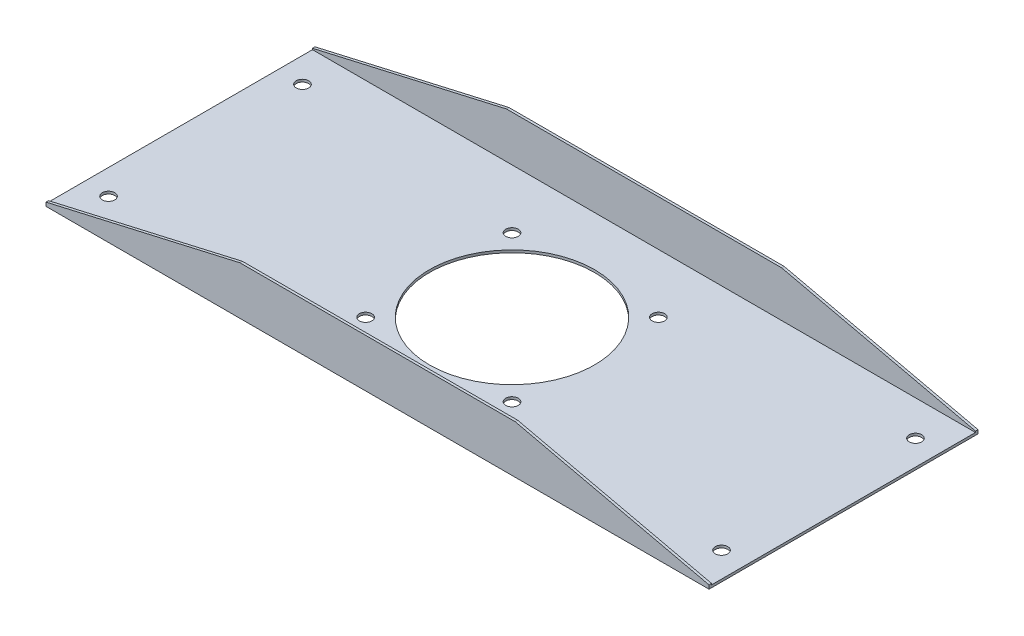
from build123d import *

# Parameters (mm, degrees)
EXTRUDE_1_DEPTH     = 530
SKETCH_2_OUTSIDE_W  = 646.648
SKETCH_2_OUTSIDE_H  = 155.148
CUT_EXTRUDE_2_DEPTH = 574.242749627
SKETCH_3_R          = 5
SKETCH_3_R_2        = 66
CUT_EXTRUDE_3_DEPTH = 543.523962604


with BuildPart() as part:
    # Эскиз1 → Вытянуть-Тонкостенный1 (new body)
    with BuildSketch(Plane(origin=(0, 0, 0), x_dir=(0, 0, -1), z_dir=(1, 0, 0))):
        Polygon((-105, 38.5), (-105, 0), (110, 0), (110, 38.5), (108, 38.5), (108, 2), (-103, 2), (-103, 38.5), align=None)
    extrude(amount=EXTRUDE_1_DEPTH)

    # Эскиз2 outside → Вырез-Вытянуть2 (cut, through all)
    with BuildSketch(Plane(origin=(0, 0, -110), x_dir=(-1, 0, 0), z_dir=(0, 0, -1))):
        with Locations((-265, 19.25)):
            Rectangle(SKETCH_2_OUTSIDE_W, SKETCH_2_OUTSIDE_H)
        Polygon((-530, 0), (-530, 3), (-375, 38.5), (-155, 38.5), (0, 3), (0, 0), align=None, mode=Mode.SUBTRACT)
    extrude(amount=-CUT_EXTRUDE_2_DEPTH, mode=Mode.SUBTRACT)

    # Эскиз3 → Вырез-Вытянуть3 (cut, through all)
    with BuildSketch(Plane(origin=(0, 2, 0), x_dir=(1, 0, 0), z_dir=(0, 1, 0))):
        with Locations((20, 80)):
            Circle(SKETCH_3_R)
        with Locations((20, -75)):
            Circle(SKETCH_3_R)
        with Locations((510, 80)):
            Circle(SKETCH_3_R)
        with Locations((510, -75)):
            Circle(SKETCH_3_R)
        with Locations((265, 2.5)):
            Circle(SKETCH_3_R_2)
        with Locations((323.513972874, 61.013972874)):
            Circle(SKETCH_3_R)
        with Locations((323.513972874, -56.013972874)):
            Circle(SKETCH_3_R)
        with Locations((206.486027126, -56.013972874)):
            Circle(SKETCH_3_R)
        with Locations((206.486027126, 61.013972874)):
            Circle(SKETCH_3_R)
    extrude(amount=-CUT_EXTRUDE_3_DEPTH, mode=Mode.SUBTRACT)


solid = part.part
